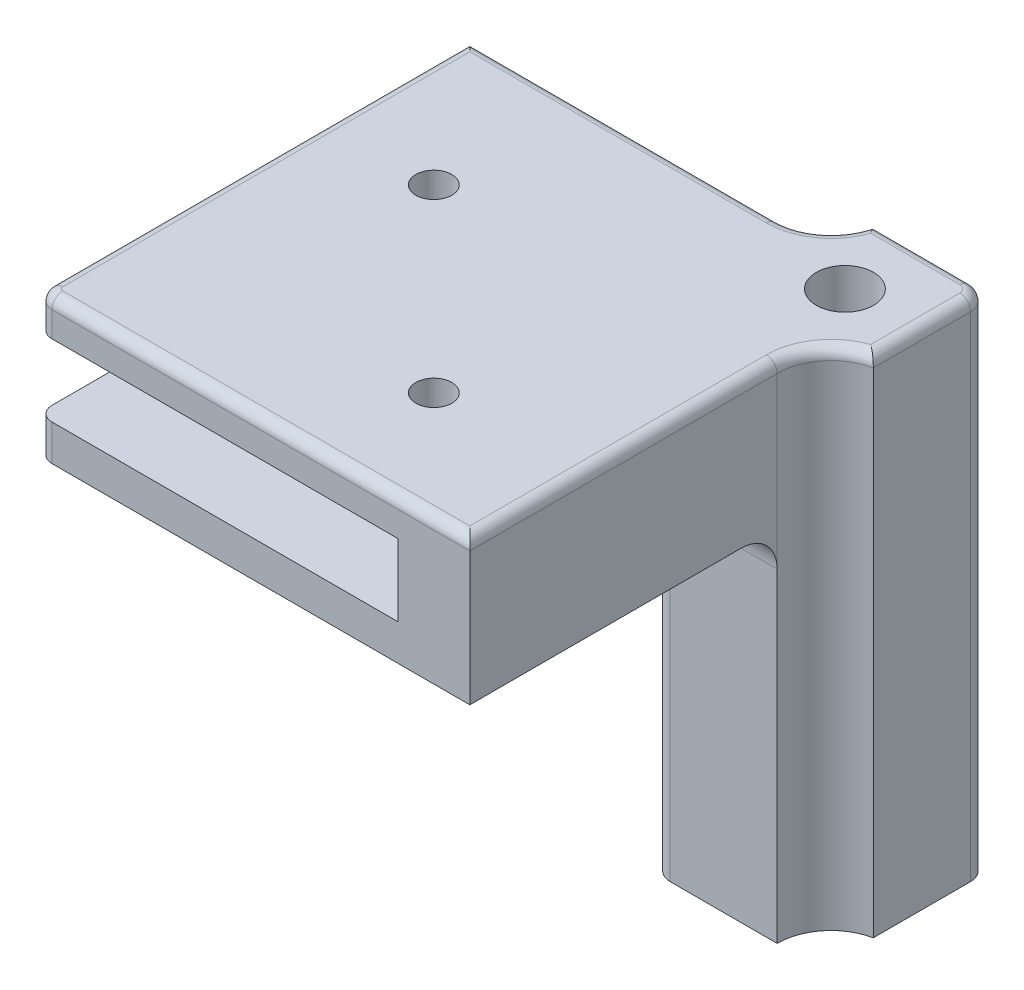
from build123d import *

# Parameters (mm, degrees)
SKETCH1_W               = 76.19999999999999
SKETCH1_H               = 76.2
BOSS_EXTRUDE1_DEPTH     = 12.7
CUT_EXTRUDE1_DEPTH      = 6.35
SKETCH4_W               = 20.320000000000007
SKETCH4_H               = 20.32
SKETCH4_R               = 5.041900000000002
BOSS_EXTRUDE2_DEPTH     = 12.7
CUT_EXTRUDE2_DEPTH      = 120.21776209944557
CUT_EXTRUDE2_DEPTH_BACK = 120.21776209944557
SKETCH4_3_R             = 5.041900000000002
FILLET2_R               = 9.525
FILLET3_R               = 3.175
CUT_EXTRUDE3_REACH      = 123.23
SKETCH5_R               = 3.174999999999997
SKETCH5_R_2             = 3.174999999999998
SKETCH6_R               = 5.041900000000002
BOSS_EXTRUDE3_DEPTH     = 63.5
CUT_EXTRUDE4_DEPTH      = 9.525
FILLET4_R               = 3.175
FILLET5_R               = 6.35
FILLET6_R               = 2.54
FILLET7_R               = 1.9049999999999998


with BuildPart() as part:
    # Sketch1 → Boss-Extrude1 (new, symmetric)
    with BuildSketch(Plane(origin=(0, 0, 0), x_dir=(1, 0, 0), z_dir=(0, 1, 0))):
        with Locations((38.099999999999994, 38.1)):
            Rectangle(SKETCH1_W, SKETCH1_H)
    extrude(amount=BOSS_EXTRUDE1_DEPTH, both=True)

    # Sketch3 → Cut-Extrude1 (cut, symmetric)
    with BuildSketch(Plane(origin=(0, 0, 0), x_dir=(1, 0, 0), z_dir=(0, 1, 0))):
        Polygon((63.499999999999986, 63.5), (-2.082e-14, 63.5), (0, 0), (63.5, 1.7e-16), align=None)
    extrude(amount=CUT_EXTRUDE1_DEPTH, both=True, mode=Mode.SUBTRACT)

    # Sketch4 → Boss-Extrude2 (add, symmetric)
    with BuildSketch(Plane(origin=(0, 0, 0), x_dir=(1, 0, 0), z_dir=(0, 1, 0))):
        with Locations((73.66, 73.66000000000001)):
            Rectangle(SKETCH4_W, SKETCH4_H)
        with Locations((71.15809999999999, 71.1581)):
            Circle(SKETCH4_R, mode=Mode.SUBTRACT)
    extrude(amount=BOSS_EXTRUDE2_DEPTH, both=True)

    # Sketch4<3> → Cut-Extrude2 (cut, two sides: drawn at the far end of the back side and taken through both)
    with BuildSketch(Plane(origin=(0, 0, 0), x_dir=(1, 0, 0), z_dir=(0, 1, 0)).offset(-CUT_EXTRUDE2_DEPTH_BACK)):
        with Locations(Location((71.15809999999999, 71.1581, 0), (0, 0, 270))):
            Circle(SKETCH4_3_R)
    extrude(amount=CUT_EXTRUDE2_DEPTH + CUT_EXTRUDE2_DEPTH_BACK, mode=Mode.SUBTRACT)

    # Fillet2
    # the kernel refuses this fillet: 9.525 mm, written as the material it adds along each edge
    with BuildSketch(Plane(origin=(63.499999999999986, -12.7, -76.2), x_dir=(-1, 0, 0), z_dir=(0, 1, 0))) as fillet2_piece_1:
        with BuildLine():
            CenterArc((9.332555920003912, -9.525000000000006), FILLET2_R, 90, 78.4630409671845)
            Line((0, -7.6200000000000045), (-0.18665111840007853, -7.5819000000000045))
            ThreePointArc((-0.18665111840007853, -7.5819000000000045), (-0.1905000000000001, -3.8100000000000023), (-0.1905000000000001, 0))
            Line((-0.1905000000000001, 0), (0, 0.1905000000000001))
            Line((0, 0.1905000000000001), (9.332555920003912, 0.1905000000000001))
            Line((9.332555920003912, 0.1905000000000001), (9.332555920003912, 0))
        make_face()
    extrude(amount=25.4)
    with BuildSketch(Plane(origin=(76.19999999999999, 12.7, -63.5), x_dir=(0, 0, 1), z_dir=(0, -1, 0))) as fillet2_piece_2:
        with BuildLine():
            CenterArc((9.332555920003905, -9.525000000000006), FILLET2_R, 90, 78.4630409671845)
            Line((0, -7.6200000000000045), (-0.18665111840007853, -7.5819000000000045))
            ThreePointArc((-0.18665111840007853, -7.5819000000000045), (-0.1905000000000001, -3.8100000000000023), (-0.1905000000000001, 0))
            Line((-0.1905000000000001, 0), (0, 0.1905000000000001))
            Line((0, 0.1905000000000001), (9.332555920003905, 0.1905000000000001))
            Line((9.332555920003905, 0.1905000000000001), (9.332555920003905, 0))
        make_face()
    extrude(amount=25.4)

    # Fillet3
    fillet3_edges = [part.edges().sort_by_distance(p)[0] for p in [
        (83.82, 0, -83.82000000000001),
    ]]
    fillet(fillet3_edges, radius=FILLET3_R)

    # Sketch5 → Cut-Extrude3 (cut, up to next)
    with BuildSketch(Plane(origin=(0, 12.7, 0), x_dir=(1, 0, 0), z_dir=(0, 1, 0)), mode=Mode.PRIVATE) as cut_extrude3_sk1:
        with Locations(Location((19.050000000000004, 50.800000000000004, 0), (0, 0, 270))):
            Circle(SKETCH5_R)
    cut_extrude3_tool1 = extrude(cut_extrude3_sk1.sketch, amount=-CUT_EXTRUDE3_REACH, mode=Mode.PRIVATE) & part.part
    # Sketch5 → Cut-Extrude3 (cut, up to next)
    with BuildSketch(Plane(origin=(0, 12.7, 0), x_dir=(1, 0, 0), z_dir=(0, 1, 0)), mode=Mode.PRIVATE) as cut_extrude3_sk2:
        with Locations(Location((50.79999999999999, 19.05, 0), (0, 0, 270))):
            Circle(SKETCH5_R_2)
    cut_extrude3_tool2 = extrude(cut_extrude3_sk2.sketch, amount=-CUT_EXTRUDE3_REACH, mode=Mode.PRIVATE) & part.part
    add(cut_extrude3_tool1.solids().sort_by_distance((19.05, 12.7, -50.8))[0], mode=Mode.SUBTRACT)
    add(cut_extrude3_tool2.solids().sort_by_distance((50.8, 12.7, -19.05))[0], mode=Mode.SUBTRACT)

    # Sketch6 → Boss-Extrude3 (add)
    with BuildSketch(Plane.XZ.offset(12.7)):
        with BuildLine():
            Line((54.16744407999608, -76.2), (54.16744407999608, -54.16744407999608))
            Line((54.16744407999608, -54.16744407999608), (76.19999999999999, -54.16744407999608))
            ThreePointArc((76.19999999999999, -54.16744407999608), (78.34696672547486, -60.191583022616854), (83.82, -63.5))
            Line((83.82, -63.5), (83.82, -80.64500000000001))
            ThreePointArc((83.82, -80.64500000000001), (82.89006403026728, -82.8900640302673), (80.645, -83.82000000000001))
            Line((80.645, -83.82000000000001), (63.499999999999986, -83.82000000000001))
            ThreePointArc((63.499999999999986, -83.82000000000001), (60.19158302261684, -78.34696672547489), (54.16744407999608, -76.2))
        make_face()
        with Locations(Location((71.15809999999999, -71.1581, 0), (0, 0, 90))):
            Circle(SKETCH6_R, mode=Mode.SUBTRACT)
    extrude(amount=BOSS_EXTRUDE3_DEPTH)

    # Sketch7 → Cut-Extrude4 (cut)
    with BuildSketch(Plane.XZ.offset(76.2)):
        Polygon((71.15809999999995, -79.9569181024499), (78.77809999999995, -75.55750905122497), (78.77809999999997, -66.75869094877508), (71.15809999999996, -62.359281897550105), (63.53809999999996, -66.75869094877504), (63.53809999999996, -75.55750905122494), align=None)
    extrude(amount=-CUT_EXTRUDE4_DEPTH, mode=Mode.SUBTRACT)

    # Fillet4
    fillet4_edges = [part.edges().sort_by_distance(p)[0] for p in [
        (54.16744407999608, -44.45, -54.16744407999608),
    ]]
    fillet(fillet4_edges, radius=FILLET4_R)

    # Fillet5
    fillet5_edges = [part.edges().sort_by_distance(p)[0] for p in [
        (66.77122203999804, -12.7, -54.16744407999608),
        (54.16744407999608, -12.7, -66.77122203999804),
        (55.09738004972879, -12.7, -55.09738004972879),
    ]]
    fillet(fillet5_edges, radius=FILLET5_R)

    # Fillet6
    fillet6_edges = [part.edges().sort_by_distance(p)[0] for p in [
        (0, -9.524999999999999, 0),
        (0, 9.524999999999999, 0),
    ]]
    fillet(fillet6_edges, radius=FILLET6_R)

    # Fillet7
    fillet7_edges = [part.edges().sort_by_distance(p)[0] for p in [
        (76.19999999999999, 12.7, -27.083722039998),
        (39.36999999999999, 12.7, 0),
        (0.7439487757861678, 12.7, -0.7439487757861698),
        (83.82, 12.7, -72.0725),
        (72.07249999999999, 12.7, -83.82000000000001),
        (0, 12.7, -39.370000000000005),
        (27.083722039998, 12.7, -76.2),
        (60.191583022616726, 12.7, -78.34696672547484),
        (78.34696672547484, 12.7, -60.191583022616726),
        (82.89006403026728, 12.7, -82.8900640302673),
    ]]
    fillet(fillet7_edges, radius=FILLET7_R)


solid = part.part
